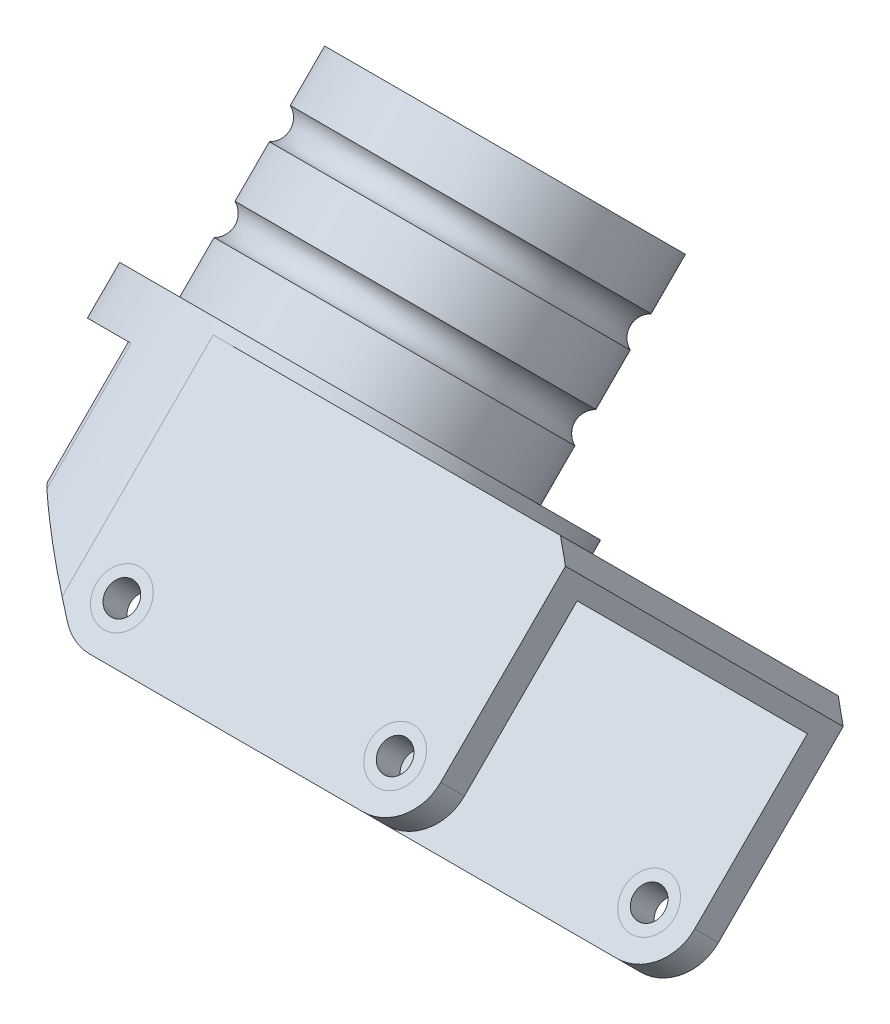
from build123d import *

# Parameters (mm, degrees)
SKETCH11_R               = 17.249999999999545
BOSS_EXTRUDE2_DEPTH      = 1
BOSS_EXTRUDE1_DEPTH      = 17.25
BOSS_EXTRUDE1_DEPTH_BACK = 17.25
CUT_EXTRUDE1_START       = -14.25
SKETCH8_W                = 52.49999999999948
SKETCH8_H                = 37.00000000000014
CUT_EXTRUDE1_DEPTH       = 28.5
M2_5_CLEARANCE_HOLE1_D   = 2.7
CUT_EXTRUDE2_DEPTH       = 287.9075330139404
MOVE_FACE1_BY            = 0.05
MOVE_FACE1_2_BY          = 0.05
FILLET3_R                = 1
SKETCH13_R               = 10.949999999999743
CUT_EXTRUDE3_DEPTH       = 287.92025460072404
CHAMFER1_SIZE            = 0.5
CHAMFER2_SIZE            = 1.5


# Read off the part's stored shape, not the designer's step: Glue_In_Plug
with BuildPart() as part:
    # Glue_In_Plug outline → Glue_In_Plug (revolve)
    with BuildSketch(Plane(origin=(0, 176.776695297, 176.776695297), x_dir=(1, 0, 0), z_dir=(0, 0.707106781186551, 0.707106781186544))):
        with BuildLine():
            Line((12.95, -137.75), (10.95, -137.75))
            Line((10.95, -137.75), (10.95, -156.75))
            Line((10.95, -156.75), (15, -156.75))
            Line((15, -156.75), (15, -155.75))
            Line((15, -155.75), (12.95, -155.75))
            Line((12.95, -155.75), (12.95, -151.482050808))
            ThreePointArc((12.95, -151.482050808), (12.2, -150.183012702), (12.95, -148.883974596))
            Line((12.95, -148.883974596), (12.95, -144.616025404))
            ThreePointArc((12.95, -144.616025404), (12.2, -143.316987298), (12.95, -142.017949192))
            Line((12.95, -142.017949192), (12.95, -137.75))
        make_face()
    revolve(axis=Axis((0, 176.776695297, 176.776695297), (0, 0.707106781186544, -0.707106781186551)))

    # Sketch11 → Boss-Extrude2 (add)
    with BuildSketch(Plane(origin=(0, -110.13188116980581, 110.13188116980702), x_dir=(1, 0, 0), z_dir=(0, 0.7071067811865438, -0.7071067811865513))):
        with Locations(Location((0, -250, 0), (0, 0, 270))):
            Circle(SKETCH11_R)
    extrude(amount=-BOSS_EXTRUDE2_DEPTH)

    # Sketch6 → Boss-Extrude1 (add, two sides: drawn at the far end of the back side and taken through both)
    with BuildSketch(Plane(origin=(0, 176.7766952966368, 176.77669529663697), x_dir=(-1, 0, 0), z_dir=(0, -0.7071067811865477, -0.7071067811865475)).offset(-BOSS_EXTRUDE1_DEPTH_BACK)):
        with BuildLine():
            Line((-32, -156.75000000000077), (-32.00000000000001, -173.7500000000009))
            ThreePointArc((-32.00000000000001, -173.7500000000009), (-30.828427124746195, -176.5784271247471), (-27.999999999999996, -177.75000000000088))
            Line((-27.999999999999996, -177.75000000000088), (-4.0000000000000036, -177.75000000000088))
            ThreePointArc((-4.0000000000000036, -177.75000000000088), (-2.5528006726860175, -177.47902321084604), (-1.3016800588632904, -176.7028070535119))
            Line((-1.3016800588632904, -176.7028070535119), (17.249999999999545, -159.75000000000082))
            Line((17.249999999999545, -159.75000000000082), (17.249999999999545, -156.75000000000077))
            Line((17.249999999999545, -156.75000000000077), (-32, -156.75000000000077))
        make_face()
    extrude(amount=BOSS_EXTRUDE1_DEPTH + BOSS_EXTRUDE1_DEPTH_BACK)

    # Sketch8 → Cut-Extrude1 (cut)
    with BuildSketch(Plane(origin=(0, 176.7766952966368, 176.77669529663697), x_dir=(-1, 0, 0), z_dir=(0, -0.7071067811865477, -0.7071067811865475)).offset(CUT_EXTRUDE1_START)):
        with Locations((-9.000000000000195, -178.2500000000009)):
            Rectangle(SKETCH8_W, SKETCH8_H)
    extrude(amount=CUT_EXTRUDE1_DEPTH, mode=Mode.SUBTRACT)

    # M2.5 Clearance Hole1 (through all)
    with Locations(Plane(origin=(0, 188.97428727210456, 188.9742872721045), x_dir=(1, 0, 0), z_dir=(0, 0.7071067811865476, 0.7071067811865476))):
        with Locations((4, -173.75), (28, -173.75)):
            Hole(M2_5_CLEARANCE_HOLE1_D / 2)

    # Sketch12 → Cut-Extrude2 (cut, through all)
    with BuildSketch(Plane(origin=(0, -110.838987950992, 110.83898795099203), x_dir=(1, 7e-16, -7e-16), z_dir=(0, 0.7071067811865476, -0.7071067811865476))):
        with BuildLine():
            Line((-17.249999999999545, -250.00000000000088), (-17.249999999999545, -267.24999999999955))
            Line((-17.249999999999545, -267.24999999999955), (0, -267.24999999999955))
            ThreePointArc((-6.1e-16, -267.24999999999955), (-12.197591975467768, -262.1975919754684), (-17.249999999999538, -250.00000000000088))
        make_face()
        with BuildLine():
            Line((-17.249999999999545, -232.7499999999995), (-17.249999999999545, -250.00000000000088))
            ThreePointArc((-17.24999999999954, -250.00000000000088), (-12.197591975468656, -237.80240802453167), (0, -232.7499999999995))
            Line((0, -232.7499999999995), (-17.249999999999545, -232.7499999999995))
        make_face()
    extrude(amount=-CUT_EXTRUDE2_DEPTH, mode=Mode.SUBTRACT)

    # Move Face1: a face moved inward by 0.05
    extrude(part.faces().sort_by_distance((12.658853914, 47.847886018, 285.552961311))[0], amount=MOVE_FACE1_BY, dir=(0, -0.707106781, -0.707106781), mode=Mode.SUBTRACT)

    # Move Face1 2: a face moved inward by 0.05
    extrude(part.faces().sort_by_distance((12.658853914, 68.000429282, 305.705504575))[0], amount=MOVE_FACE1_2_BY, dir=(0, 0.707106781, 0.707106781), mode=Mode.SUBTRACT)

    # Fillet3
    fillet3_edges = [part.edges().sort_by_distance(p)[0] for p in [
        (-9.647408978600675, 71.47175017032276, 302.3048943648676),
        (-9.647408978601732, 51.24849622840657, 282.0816404229506),
    ]]
    fillet(fillet3_edges, radius=FILLET3_R)

    # Sketch13 → Cut-Extrude3 (cut, through all)
    with BuildSketch(Plane(origin=(0, -110.13188116980584, 110.13188116980702), x_dir=(1, 0, 0), z_dir=(0, 0.7071067811865438, -0.7071067811865512))):
        with Locations(Location((0, -250.0000000000001, 0), (0, 0, 90))):
            Circle(SKETCH13_R)
    extrude(amount=-CUT_EXTRUDE3_DEPTH, mode=Mode.SUBTRACT)

    # Chamfer1
    chamfer1_edges = [part.edges().sort_by_distance(p)[0] for p in [
        (-2.01e-15, 71.55920625607847, 297.4798228451817),
    ]]
    chamfer(chamfer1_edges, length=CHAMFER1_SIZE)

    # Chamfer2
    chamfer2_edges = [part.edges().sort_by_distance(p)[0] for p in [
        (32, 65.93770734564494, 287.6156832476289),
    ]]
    chamfer(chamfer2_edges, length=CHAMFER2_SIZE)


solid = part.part
